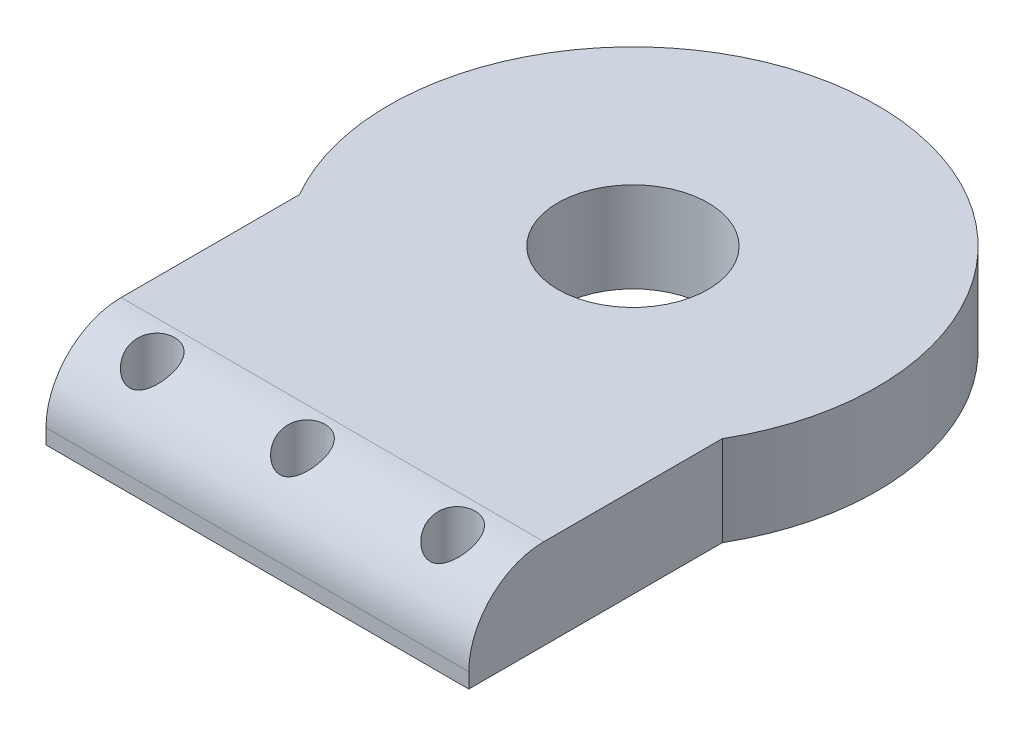
from build123d import *

# Parameters (mm, degrees)
EXTRUDE_1_DEPTH     = 12
SKETCH_2_R          = 3
CUT_EXTRUDE_1_DEPTH = 12
FILLET_1_R          = 10
SKETCH_3_R          = 10
CUT_EXTRUDE_2_DEPTH = 12


with BuildPart() as part:
    # 草图1 → 凸台-拉伸1 (new body)
    with BuildSketch(Plane(origin=(0, 0, 0), x_dir=(1, 0, 0), z_dir=(0, 1, 0))):
        with BuildLine():
            Line((-28.145825623, 33.75), (0, 50))
            Line((0, 50), (28.145825623, 33.75))
            ThreePointArc((28.145825623, 33.75), (31.392589354, 41.588381034), (32.5, 50))
            ThreePointArc((32.5, 50), (-8.411618966, 81.392589354), (-28.145825623, 33.75))
        make_face()
        with BuildLine():
            Line((0, 50), (0, 17.5))
            ThreePointArc((0, 17.5), (16.25, 21.854174377), (28.145825623, 33.75))
            Line((28.145825623, 33.75), (0, 50))
        make_face()
        with BuildLine():
            ThreePointArc((-28.145825623, 33.75), (-16.25, 21.854174377), (0, 17.5))
            Line((0, 17.5), (0, 50))
            Line((0, 50), (-28.145825623, 33.75))
        make_face()
        with BuildLine():
            Line((-28.145825623, 0), (0, 0))
            Line((0, 0), (0, 17.5))
            ThreePointArc((0, 17.5), (-16.25, 21.854174377), (-28.145825623, 33.75))
            Line((-28.145825623, 33.75), (-28.145825623, 0))
        make_face()
        with BuildLine():
            Line((0, 17.5), (0, 0))
            Line((0, 0), (28.145825623, 0))
            Line((28.145825623, 0), (28.145825623, 33.75))
            ThreePointArc((28.145825623, 33.75), (16.25, 21.854174377), (0, 17.5))
        make_face()
    extrude(amount=EXTRUDE_1_DEPTH)

    # 草图2 → 切除-拉伸1 (cut)
    with BuildSketch(Plane(origin=(0, 0, 0), x_dir=(-1, 0, 0), z_dir=(0, -1, 0))):
        with Locations(Location((0, 6, 0), (0, 0, 90))):
            Circle(SKETCH_2_R)
        with Locations(Location((20, 6, 0), (0, 0, 90))):
            Circle(SKETCH_2_R)
        with Locations(Location((-20, 6, 0), (0, 0, 90))):
            Circle(SKETCH_2_R)
    extrude(amount=-CUT_EXTRUDE_1_DEPTH, mode=Mode.SUBTRACT)

    # 圆角1
    # the kernel refuses this fillet: 10 mm, written as the material it takes off along each edge
    with BuildSketch(Plane(origin=(-53.145825623, 12, 0), x_dir=(0, 0, -1), z_dir=(1, 0, 0))) as fillet_1_piece_1:
        with BuildLine():
            CenterArc((FILLET_1_R, -FILLET_1_R), FILLET_1_R, 90, 90)
            Line((0, -FILLET_1_R), (0, 0))
            Line((0, 0), (FILLET_1_R, 0))
        make_face()
    extrude(amount=106.291651246, mode=Mode.SUBTRACT)

    # 草图3 → 切除-拉伸2 (cut)
    with BuildSketch(Plane(origin=(0, 12, 0), x_dir=(1, 0, 0), z_dir=(0, 1, 0))):
        with Locations(Location((0, 50, 0), (0, 0, 270))):
            Circle(SKETCH_3_R)
    extrude(amount=-CUT_EXTRUDE_2_DEPTH, mode=Mode.SUBTRACT)


solid = part.part
